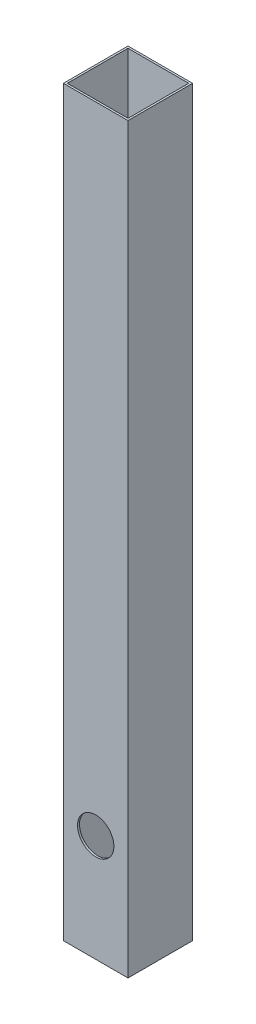
from build123d import *

# Parameters (mm, degrees)
SKETCH1_W               = 50.8
SKETCH1_H               = 50.8
SKETCH1_W_2             = 47.752
SKETCH1_H_2             = 47.752
EXTRUDE_THIN1_DEPTH     = 584.2
CUT_EXTRUDE1_DEPTH      = 586.303305988
CUT_EXTRUDE1_DEPTH_BACK = 586.303305988
SKETCH2_R               = 14.2875


with BuildPart() as part:
    # Sketch1 → Extrude-Thin1 (new body)
    with BuildSketch(Plane(origin=(0, 0, 0), x_dir=(1, 0, 0), z_dir=(0, 1, 0))):
        Rectangle(SKETCH1_W, SKETCH1_H)
        Rectangle(SKETCH1_W_2, SKETCH1_H_2, mode=Mode.SUBTRACT)
    extrude(amount=EXTRUDE_THIN1_DEPTH)

    # Sketch2 → Cut-Extrude1 (cut, two sides: drawn at the far end of the back side and taken through both)
    with BuildSketch(Plane.XY.offset(-CUT_EXTRUDE1_DEPTH_BACK)):
        with Locations((0, 84.1375)):
            Circle(SKETCH2_R)
    extrude(amount=CUT_EXTRUDE1_DEPTH + CUT_EXTRUDE1_DEPTH_BACK, mode=Mode.SUBTRACT)


solid = part.part
